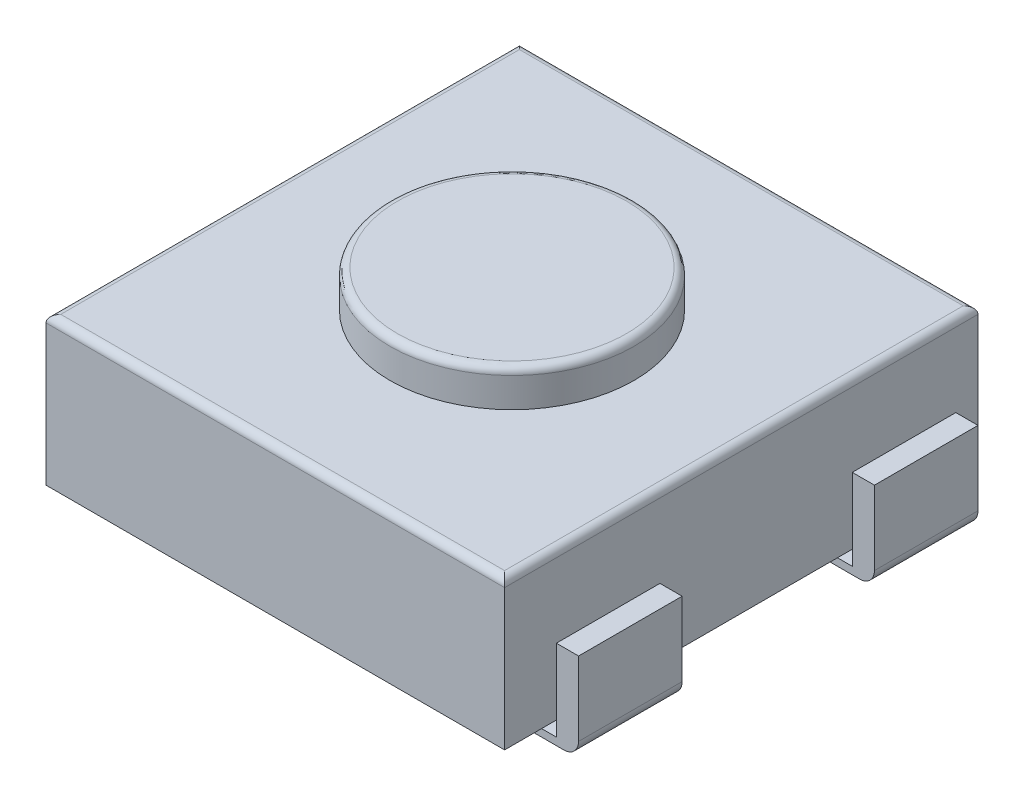
from build123d import *

# Parameters (mm, degrees)
ESQUISSE1_W           = 6.2
ESQUISSE1_H           = 6.4
BOSS_EXTRU_1_DEPTH    = 2
ESQUISSE2_R           = 1.65
BOSS_EXTRU_2_DEPTH    = 0.5
BOSS_EXTRU_4_START    = 1.3
BOSS_EXTRU_4_DEPTH    = 1.4
CONG_2_R              = 0.2
CONG_2_OF_SYM_TRIE2_R = 0.2
CONG_3_R              = 0.1
CONG_4_R              = 0.1


with BuildPart() as part:
    # Esquisse1 → Boss.-Extru.1 (new body)
    with BuildSketch(Plane(origin=(0, 0, 0), x_dir=(1, 0, 0), z_dir=(0, 1, 0))):
        Rectangle(ESQUISSE1_W, ESQUISSE1_H)
    extrude(amount=BOSS_EXTRU_1_DEPTH)

    # Esquisse2 → Boss.-Extru.2 (add)
    with BuildSketch(Plane(origin=(0, 2, 0), x_dir=(1, 0, 0), z_dir=(0, 1, 0))):
        with Locations(Location((0, 0, 0), (0, 0, 270))):
            Circle(ESQUISSE2_R)
    extrude(amount=BOSS_EXTRU_2_DEPTH)

    # Esquisse4 → Boss.-Extru.4 (add)
    with BuildSketch(Plane.XY.offset(BOSS_EXTRU_4_START)):
        Polygon((3.1, 0), (2.4, 0), (2.4, -0.1), (3.6, -0.1), (3.6, 1.1), (3.3, 1.1), (3.3, 0), align=None)
        Polygon((-2.4, -0.1), (-2.4, 0), (-3.3, 0), (-3.3, 1.1), (-3.6, 1.1), (-3.6, -0.1), align=None)
    boss_extru_4 = extrude(amount=BOSS_EXTRU_4_DEPTH)

    # Congé2
    # the kernel refuses this fillet: 0.2 mm, written as the material it takes off along each edge
    with BuildSketch(Plane(origin=(-2.4, -0.1, 0.866987298), x_dir=(0, 1, 0), z_dir=(0, 0, 1))) as cong_2_piece_1:
        with BuildLine():
            CenterArc((0.2, 0.173205081), CONG_2_R, 180, 60)
            Line((0, 0.173205081), (-0.004, 0.173205081))
            Line((-0.004, 0.173205081), (-0.004, 0))
            Line((-0.004, 0), (0, -0.004))
            ThreePointArc((0, -0.004), (0.05, -0.004), (0.098, -0.003464102))
            Line((0.098, -0.003464102), (0.1, 0))
        make_face()
    extrude(amount=2.266025404, mode=Mode.SUBTRACT)
    with BuildSketch(Plane(origin=(2.4, -0.1, 0.866987298), x_dir=(0, 1, 0), z_dir=(0, 0, 1))) as cong_2_piece_2:
        with BuildLine():
            CenterArc((0.2, -0.173205081), CONG_2_R, 120, 60)
            Line((0, -0.173205081), (-0.004, -0.173205081))
            Line((-0.004, -0.173205081), (-0.004, 0))
            Line((-0.004, 0), (0, 0.004))
            ThreePointArc((0, 0.004), (0.05, 0.004), (0.098, 0.003464102))
            Line((0.098, 0.003464102), (0.1, 0))
        make_face()
    extrude(amount=2.266025404, mode=Mode.SUBTRACT)
    with BuildSketch(Plane(origin=(3.6, -0.1, 0.8), x_dir=(0, 1, 0), z_dir=(0, 0, 1))) as cong_2_piece_3:
        with BuildLine():
            CenterArc((CONG_2_R, CONG_2_R), CONG_2_R, 180, 90)
            Line((0, CONG_2_R), (-CONG_2_R * 0.02, CONG_2_R))
            Line((-CONG_2_R * 0.02, CONG_2_R), (-CONG_2_R * 0.02, -CONG_2_R * 0.02))
            Line((-CONG_2_R * 0.02, -CONG_2_R * 0.02), (CONG_2_R, -CONG_2_R * 0.02))
            Line((CONG_2_R, -CONG_2_R * 0.02), (CONG_2_R, 0))
        make_face()
    extrude(amount=2.4, mode=Mode.SUBTRACT)
    with BuildSketch(Plane(origin=(-3.6, -0.1, 0.8), x_dir=(0, 1, 0), z_dir=(0, 0, 1))) as cong_2_piece_4:
        with BuildLine():
            CenterArc((CONG_2_R, -CONG_2_R), CONG_2_R, 90, 90)
            Line((0, -CONG_2_R), (-CONG_2_R * 0.02, -CONG_2_R))
            Line((-CONG_2_R * 0.02, -CONG_2_R), (-CONG_2_R * 0.02, CONG_2_R * 0.02))
            Line((-CONG_2_R * 0.02, CONG_2_R * 0.02), (CONG_2_R, CONG_2_R * 0.02))
            Line((CONG_2_R, CONG_2_R * 0.02), (CONG_2_R, 0))
        make_face()
    extrude(amount=2.4, mode=Mode.SUBTRACT)

    # Symétrie2: Boss.-Extru.4 across plane
    add(boss_extru_4.mirror(Plane.XY))

    # Congé2 of Symétrie2
    # the kernel refuses this fillet: 0.2 mm, written as the material it takes off along each edge
    with BuildSketch(Plane(origin=(-2.4, -0.1, -0.866987298), x_dir=(0, 1, 0), z_dir=(0, 0, -1))) as cong_2_of_sym_trie2_piece_1:
        with BuildLine():
            CenterArc((0.2, -0.173205081), CONG_2_OF_SYM_TRIE2_R, 120, 60)
            Line((0, -0.173205081), (-0.004, -0.173205081))
            Line((-0.004, -0.173205081), (-0.004, 0))
            Line((-0.004, 0), (0, 0.004))
            ThreePointArc((0, 0.004), (0.05, 0.004), (0.098, 0.003464102))
            Line((0.098, 0.003464102), (0.1, 0))
        make_face()
    extrude(amount=2.266025404, mode=Mode.SUBTRACT)
    with BuildSketch(Plane(origin=(2.4, -0.1, -0.866987298), x_dir=(0, 1, 0), z_dir=(0, 0, -1))) as cong_2_of_sym_trie2_piece_2:
        with BuildLine():
            CenterArc((0.2, 0.173205081), CONG_2_OF_SYM_TRIE2_R, 180, 60)
            Line((0, 0.173205081), (-0.004, 0.173205081))
            Line((-0.004, 0.173205081), (-0.004, 0))
            Line((-0.004, 0), (0, -0.004))
            ThreePointArc((0, -0.004), (0.05, -0.004), (0.098, -0.003464102))
            Line((0.098, -0.003464102), (0.1, 0))
        make_face()
    extrude(amount=2.266025404, mode=Mode.SUBTRACT)
    with BuildSketch(Plane(origin=(3.6, -0.1, -0.8), x_dir=(0, 1, 0), z_dir=(0, 0, -1))) as cong_2_of_sym_trie2_piece_3:
        with BuildLine():
            CenterArc((CONG_2_OF_SYM_TRIE2_R, -CONG_2_OF_SYM_TRIE2_R), CONG_2_OF_SYM_TRIE2_R, 90, 90)
            Line((0, -CONG_2_OF_SYM_TRIE2_R), (-CONG_2_OF_SYM_TRIE2_R * 0.02, -CONG_2_OF_SYM_TRIE2_R))
            Line((-CONG_2_OF_SYM_TRIE2_R * 0.02, -CONG_2_OF_SYM_TRIE2_R), (-CONG_2_OF_SYM_TRIE2_R * 0.02, CONG_2_OF_SYM_TRIE2_R * 0.02))
            Line((-CONG_2_OF_SYM_TRIE2_R * 0.02, CONG_2_OF_SYM_TRIE2_R * 0.02), (CONG_2_OF_SYM_TRIE2_R, CONG_2_OF_SYM_TRIE2_R * 0.02))
            Line((CONG_2_OF_SYM_TRIE2_R, CONG_2_OF_SYM_TRIE2_R * 0.02), (CONG_2_OF_SYM_TRIE2_R, 0))
        make_face()
    extrude(amount=2.4, mode=Mode.SUBTRACT)
    with BuildSketch(Plane(origin=(-3.6, -0.1, -0.8), x_dir=(0, 1, 0), z_dir=(0, 0, -1))) as cong_2_of_sym_trie2_piece_4:
        with BuildLine():
            CenterArc((CONG_2_OF_SYM_TRIE2_R, CONG_2_OF_SYM_TRIE2_R), CONG_2_OF_SYM_TRIE2_R, 180, 90)
            Line((0, CONG_2_OF_SYM_TRIE2_R), (-CONG_2_OF_SYM_TRIE2_R * 0.02, CONG_2_OF_SYM_TRIE2_R))
            Line((-CONG_2_OF_SYM_TRIE2_R * 0.02, CONG_2_OF_SYM_TRIE2_R), (-CONG_2_OF_SYM_TRIE2_R * 0.02, -CONG_2_OF_SYM_TRIE2_R * 0.02))
            Line((-CONG_2_OF_SYM_TRIE2_R * 0.02, -CONG_2_OF_SYM_TRIE2_R * 0.02), (CONG_2_OF_SYM_TRIE2_R, -CONG_2_OF_SYM_TRIE2_R * 0.02))
            Line((CONG_2_OF_SYM_TRIE2_R, -CONG_2_OF_SYM_TRIE2_R * 0.02), (CONG_2_OF_SYM_TRIE2_R, 0))
        make_face()
    extrude(amount=2.4, mode=Mode.SUBTRACT)

    # Congé3
    cong_3_edges = [part.edges().sort_by_distance(p)[0] for p in [
        (0, 2.5, -1.65),
    ]]
    fillet(cong_3_edges, radius=CONG_3_R)

    # Congé4
    cong_4_edges = [part.edges().sort_by_distance(p)[0] for p in [
        (3.1, 2, 0),
        (0, 2, -3.2),
        (-3.1, 2, 0),
        (0, 2, 3.2),
    ]]
    fillet(cong_4_edges, radius=CONG_4_R)


solid = part.part
